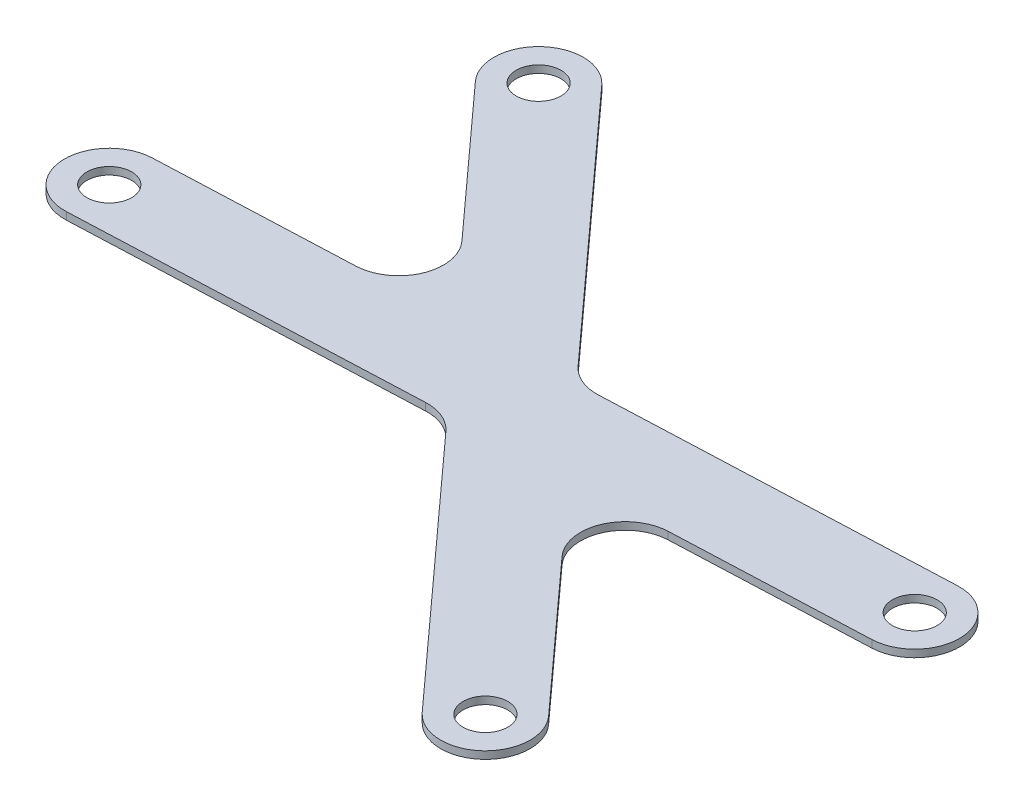
from build123d import *

# Parameters (mm, degrees)
SKETCH1_R           = 3
BOSS_EXTRUDE1_DEPTH = 1


with BuildPart() as part:
    # Sketch1 → Boss-Extrude1 (new body)
    with BuildSketch(Plane(origin=(0, 0, 0), x_dir=(1, 0, 0), z_dir=(0, 1, 0))):
        with BuildLine():
            Line((-51.59997019, -8.15126226), (-5.362841244, -6.228231034))
            ThreePointArc((-5.362841244, -6.228231034), (-2.79788364, -6.687900671), (-0.669699001, -8.191607368))
            Line((-0.669699001, -8.191607368), (30.424202227, -42.466079626))
            ThreePointArc((30.424202227, -42.466079626), (38.899457299, -42.878452603), (39.311830275, -34.403197532))
            Line((39.311830275, -34.403197532), (21.669062136, -14.955764328))
            ThreePointArc((21.669062136, -14.955764328), (20.577728416, -8.608693896), (25.863547941, -4.929505899))
            Line((25.863547941, -4.929505899), (52.098626628, -3.838372503))
            ThreePointArc((52.098626628, -3.838372503), (57.84411579, 2.405773098), (51.59997019, 8.15126226))
            Line((51.59997019, 8.15126226), (5.362841244, 6.228231034))
            ThreePointArc((5.362841244, 6.228231034), (2.79788364, 6.687900671), (0.669699001, 8.191607368))
            Line((0.669699001, 8.191607368), (-30.424202227, 42.466079626))
            ThreePointArc((-30.424202227, 42.466079626), (-38.899457299, 42.878452603), (-39.311830275, 34.403197532))
            Line((-39.311830275, 34.403197532), (-21.669062136, 14.955764328))
            ThreePointArc((-21.669062136, 14.955764328), (-20.577728416, 8.608693896), (-25.863547941, 4.929505899))
            Line((-25.863547941, 4.929505899), (-52.098626628, 3.838372503))
            ThreePointArc((-52.098626628, 3.838372503), (-57.84411579, -2.405773098), (-51.59997019, -8.15126226))
        make_face()
        with Locations(Location((-34.868016251, 38.434638579, 0), (0, 0, 270))):
            Circle(SKETCH1_R, mode=Mode.SUBTRACT)
        with Locations(Location((51.849298409, 2.156444879, 0), (0, 0, 270))):
            Circle(SKETCH1_R, mode=Mode.SUBTRACT)
        with Locations(Location((34.868016251, -38.434638579, 0), (0, 0, 270))):
            Circle(SKETCH1_R, mode=Mode.SUBTRACT)
        with Locations(Location((-51.849298409, -2.156444879, 0), (0, 0, 270))):
            Circle(SKETCH1_R, mode=Mode.SUBTRACT)
    extrude(amount=BOSS_EXTRUDE1_DEPTH)


solid = part.part
